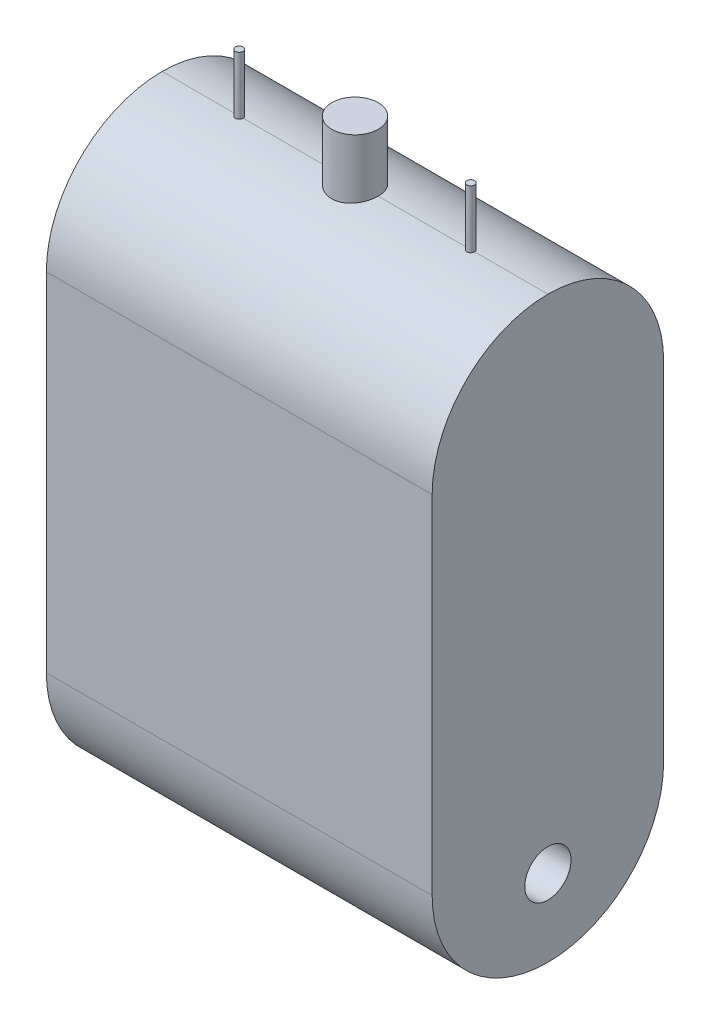
from build123d import *

# Parameters (mm, degrees)
EXTRUDE_1_DEPTH     = 30
SKETCH_2_R          = 3
CUT_EXTRUDE_1_DEPTH = 52
FILLET_1_R          = 15
FILLET_2_R          = 15
FILLET_3_R          = 15
FILLET_4_R          = 15
SKETCH_4_R          = 3
SKETCH_4_R_2        = 0.5
EXTRUDE_2_DEPTH     = 50
SKETCH_5_R          = 3
SKETCH_5_R_2        = 0.5
EXTRUDE_3_DEPTH     = 37


with BuildPart() as part:
    # 草图1 → 凸台-拉伸1 (new body)
    with BuildSketch(Plane.XY):
        Polygon((25, 0), (25, 42.5), (-25, 42.5), (-25, -32.5), (25, -32.5), align=None)
    extrude(amount=EXTRUDE_1_DEPTH)

    # 草图2 → 切除-拉伸1 (cut)
    with BuildSketch(Plane(origin=(25, 0, 0), x_dir=(0, 0, -1), z_dir=(1, 0, 0))):
        with Locations((-15, -22.5)):
            Circle(SKETCH_2_R)
    extrude(amount=-CUT_EXTRUDE_1_DEPTH, mode=Mode.SUBTRACT)

    # 圆角1
    fillet_1_edges = [part.edges().sort_by_distance(p)[0] for p in [
        (0, -32.5, 0),
    ]]
    fillet(fillet_1_edges, radius=FILLET_1_R)

    # 圆角2
    fillet_2_edges = [part.edges().sort_by_distance(p)[0] for p in [
        (0, -32.5, 30),
    ]]
    fillet(fillet_2_edges, radius=FILLET_2_R - 0.0001)  # a hair under: the kernel refuses the full size

    # 圆角3
    fillet_3_edges = [part.edges().sort_by_distance(p)[0] for p in [
        (0, 42.5, 30),
    ]]
    fillet(fillet_3_edges, radius=FILLET_3_R)

    # 圆角4
    fillet_4_edges = [part.edges().sort_by_distance(p)[0] for p in [
        (0, 42.5, 0),
    ]]
    fillet(fillet_4_edges, radius=FILLET_4_R - 0.0001)  # a hair under: the kernel refuses the full size

    # 草图4 → 凸台-拉伸2 (add)
    with BuildSketch(Plane(origin=(0, 0, 0), x_dir=(1, 0, 0), z_dir=(0, 1, 0))):
        with Locations((0, -15)):
            Circle(SKETCH_4_R)
        with Locations((15, -15)):
            Circle(SKETCH_4_R_2)
        with Locations((-15, -15)):
            Circle(SKETCH_4_R_2)
    extrude(amount=EXTRUDE_2_DEPTH)

    # 草图5 → 凸台-拉伸3 (add)
    with BuildSketch(Plane.XY.offset(30)):
        with Locations((0, 5)):
            Circle(SKETCH_5_R)
        with Locations((-15, 5)):
            Circle(SKETCH_5_R_2)
        with Locations((15, 5)):
            Circle(SKETCH_5_R_2)
    extrude(amount=-EXTRUDE_3_DEPTH)


solid = part.part
